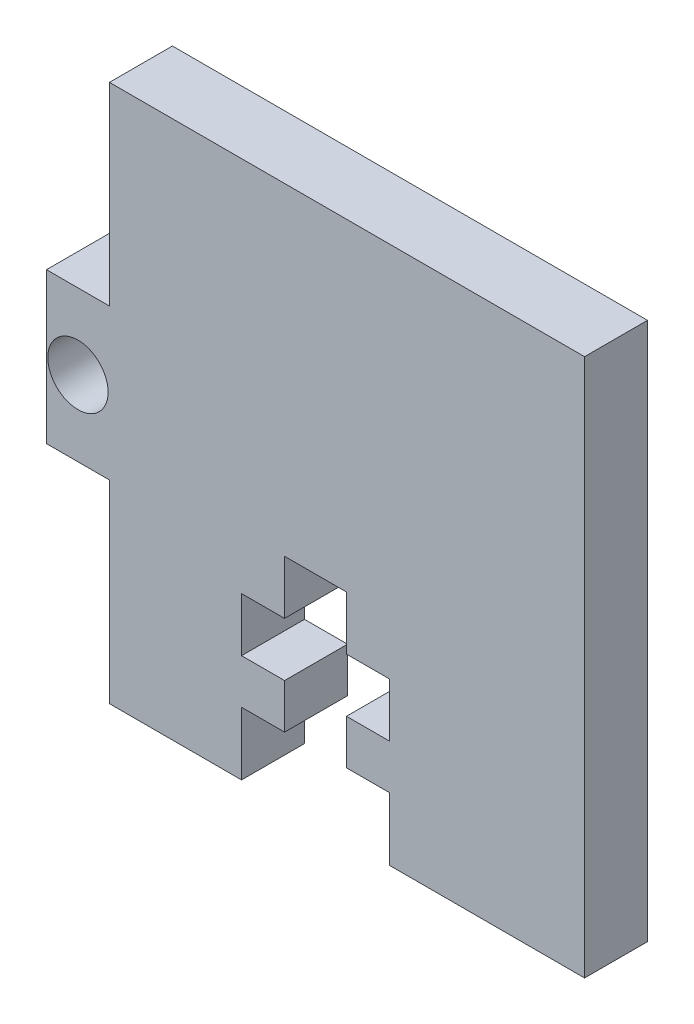
from build123d import *

# Parameters (mm, degrees)
SKETCH1_R           = 1.4224
BOSS_EXTRUDE1_DEPTH = 2.9718


with BuildPart() as part:
    # Sketch1 → Boss-Extrude1 (new body)
    with BuildSketch(Plane.XY):
        Polygon((2.9718, 25.4), (2.9718, 16.256), (0, 16.256), (0, 9.144), (2.9718, 9.144), (2.9718, 0), (9.2075, 0), (9.2075, 2.9718), (11.2395, 2.9718), (11.2395, 5.08), (9.2075, 5.08), (9.2075, 7.62), (11.2395, 7.62), (11.2395, 10.16), (14.1605, 10.16), (14.1605, 7.62), (16.1925, 7.62), (16.1925, 5.08), (14.1605, 5.08), (14.1605, 2.9718), (16.1925, 2.9718), (16.1925, 0), (25.4, 0), (25.4, 25.4), align=None)
        with Locations((1.4859, 12.7)):
            Circle(SKETCH1_R, mode=Mode.SUBTRACT)
    extrude(amount=BOSS_EXTRUDE1_DEPTH)


solid = part.part
